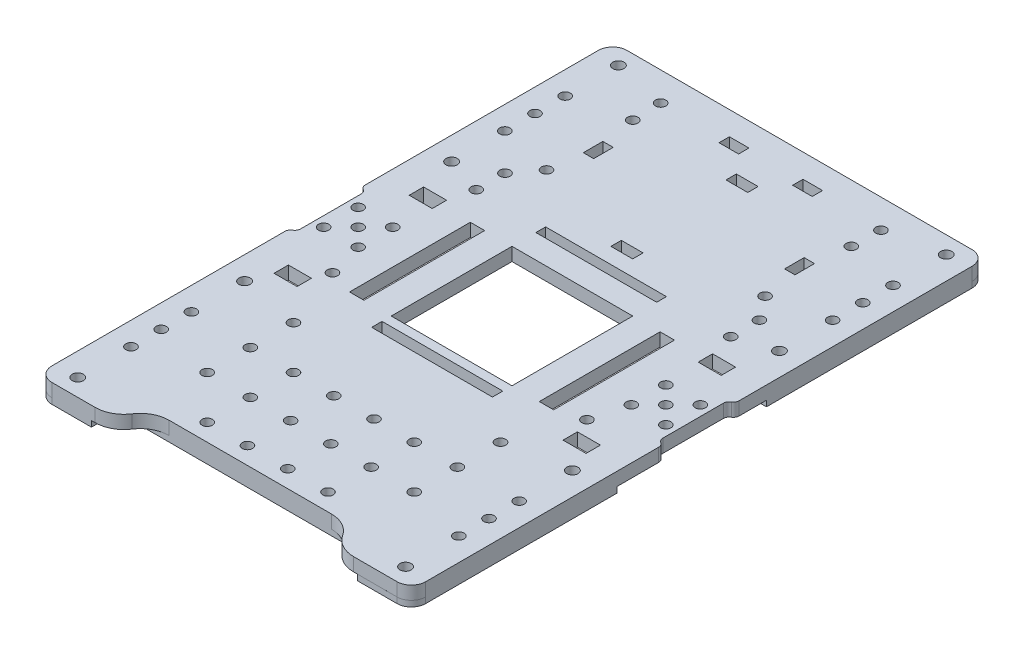
from build123d import *
from build123d.topology import SkipClean

# Parameters (mm, degrees)
SKETCH_2_W           = 130
SKETCH_2_H           = 200
SKETCH_2_R           = 1.8
EXTRUDE_1_DEPTH      = 4.6
FILLET_1_R           = 5
SKETCH_3_W           = 4
SKETCH_3_H           = 24
CUT_EXTRUDE_1_DEPTH  = 4.6
FILLET_2_R           = 2
FILLET_3_R           = 2
SKETCH_4_R           = 1.8
SKETCH_4_R_2         = 1.95
CUT_EXTRUDE_2_DEPTH  = 4.6
SKETCH_5_R           = 1.8
SKETCH_5_W           = 6.8
SKETCH_5_H           = 3.6
SKETCH_5_W_2         = 42
SKETCH_5_H_2         = 42
SKETCH_5_H_3         = 3.4
SKETCH_5_W_3         = 70
SKETCH_5_H_4         = 18
CUT_EXTRUDE_3_DEPTH  = 4.6
FILLET_4_R           = 10
FILLET_5_R           = 10
SKETCH_6_R           = 1.8
CUT_EXTRUDE_4_DEPTH  = 4.6
SKETCH_7_R           = 1.8
CUT_EXTRUDE_5_DEPTH  = 4.6
SKETCH_8_W           = 7.56096601
SKETCH_8_H           = 3.597038402
SKETCH_8_H_2         = 3.621629188
SKETCH_8_W_2         = 3.6
SKETCH_8_H_3         = 6.8
CUT_EXTRUDE_6_DEPTH  = 4.6
SKETCH_10_R          = 1.8
CUT_EXTRUDE_8_DEPTH  = 4.6
SKETCH_9_W           = 8
SKETCH_9_H           = 5
SKETCH_9_W_2         = 5
SKETCH_9_H_2         = 42
CUT_EXTRUDE_9_DEPTH  = 4.6
EXTRUDE_START        = 2
SKETCH_12_W          = 18.75
SKETCH_12_H          = 71.5
SKETCH_12_R          = 1.95
SKETCH_12_R_2        = 1.8
SKETCH_12_R_3        = 1.814304703
SKETCH_12_W_2        = 4
SKETCH_12_H_2        = 2
SKETCH_12_W_3        = 44.25
SKETCH_12_H_3        = 9.499668345
SKETCH_12_H_4        = 71.502072164
SKETCH_12_H_5        = 4.00066331
SKETCH_12_H_6        = 10.999668345
SKETCH_12_H_7        = 10.799999999
SKETCH_12_W_4        = 15.750000002
SKETCH_12_H_8        = 4
SKETCH_12_W_5        = 24.499999998
SKETCH_12_W_6        = 24.5
SKETCH_12_W_7        = 15.75
SKETCH_12_H_9        = 11
SKETCH_12_H_10       = 10.8
SKETCH_12_H_11       = 0.5
SKETCH_12_W_8        = 15.750000003
SKETCH_12_W_9        = 3.999999999
SKETCH_12_W_10       = 14.75
SKETCH_12_H_12       = 76.497927836
SKETCH_12_H_13       = 76.5
SKETCH_12_H_14       = 11.97
SKETCH_12_H_15       = 9.167588033
SKETCH_12_H_16       = 0.69
SKETCH_12_H_17       = 1.832411967
SKETCH_12_H_18       = 1.142411967
SKETCH_12_H_19       = 1.059701493
SKETCH_12_H_20       = 8.290597014
SKETCH_12_H_21       = 1.559701493
EXTRUDE_2_DEPTH      = 2
SKETCH_13_W          = 30
SKETCH_13_H          = 4
EXTRUDE_3_DEPTH      = 2
FILLET_6_R           = 5
SKETCH_14_W          = 42
SKETCH_14_H          = 3.4
EXTRUDE_4_DEPTH      = 4.6
SKETCH_15_W          = 42
SKETCH_15_H          = 3.6
CUT_EXTRUDE_10_DEPTH = 10


# Some blends are built 0.0001 mm under size
with BuildPart() as part:
    # 草图2 → 凸台-拉伸1 (new body)
    with BuildSketch(Plane(origin=(0, 0, 0), x_dir=(1, 0, 0), z_dir=(0, 1, 0))):
        Rectangle(SKETCH_2_W, SKETCH_2_H)
        with Locations(Location((-59.5, 6, 0), (0, 0, 270))):
            Circle(SKETCH_2_R, mode=Mode.SUBTRACT)
        with Locations(Location((-47.5, 6, 0), (0, 0, 270))):
            Circle(SKETCH_2_R, mode=Mode.SUBTRACT)
        with Locations(Location((-59.5, -6, 0), (0, 0, 270))):
            Circle(SKETCH_2_R, mode=Mode.SUBTRACT)
        with Locations(Location((-47.5, -6, 0), (0, 0, 270))):
            Circle(SKETCH_2_R, mode=Mode.SUBTRACT)
        with Locations(Location((-53.5, 0, 0), (0, 0, 270))):
            Circle(SKETCH_2_R, mode=Mode.SUBTRACT)
        with Locations(Location((53.5, 0, 0), (0, 0, 270))):
            Circle(SKETCH_2_R, mode=Mode.SUBTRACT)
        with Locations(Location((59.5, 6, 0), (0, 0, 270))):
            Circle(SKETCH_2_R, mode=Mode.SUBTRACT)
        with Locations(Location((59.5, -6, 0), (0, 0, 270))):
            Circle(SKETCH_2_R, mode=Mode.SUBTRACT)
        with Locations(Location((47.5, -6, 0), (0, 0, 270))):
            Circle(SKETCH_2_R, mode=Mode.SUBTRACT)
        with Locations(Location((47.5, 6, 0), (0, 0, 270))):
            Circle(SKETCH_2_R, mode=Mode.SUBTRACT)
    extrude(amount=EXTRUDE_1_DEPTH)

    # 圆角1
    fillet_1_edges = [part.edges().sort_by_distance(p)[0] for p in [
        (65, 2.3, 100),
        (-65, 2.3, 100),
        (-65, 2.3, -100),
        (65, 2.3, -100),
    ]]
    fillet(fillet_1_edges, radius=FILLET_1_R)

    # 草图3 → 切除-拉伸1 (cut)
    with BuildSketch(Plane(origin=(0, 4.6, 0), x_dir=(1, 0, 0), z_dir=(0, 1, 0))):
        with Locations((-65, 0)):
            Rectangle(SKETCH_3_W, SKETCH_3_H)
        with Locations((65, 0)):
            Rectangle(SKETCH_3_W, SKETCH_3_H)
    extrude(amount=-CUT_EXTRUDE_1_DEPTH, mode=Mode.SUBTRACT)

    # 圆角2
    fillet_2_edges = [part.edges().sort_by_distance(p)[0] for p in [
        (65, 2.3, 12),
        (65, 2.3, -12),
        (-65, 2.3, 12),
        (-65, 2.3, -12),
    ]]
    fillet(fillet_2_edges, radius=FILLET_2_R - 0.0001)  # a hair under: the kernel refuses the full size

    # 圆角3
    fillet_3_edges = [part.edges().sort_by_distance(p)[0] for p in [
        (-63, 2.3, 12),
        (-63, 2.3, -12),
        (63, 2.3, -12),
        (63, 2.3, 12),
    ]]
    fillet(fillet_3_edges, radius=FILLET_3_R)

    # 草图4 → 切除-拉伸2 (cut)
    with BuildSketch(Plane(origin=(0, 0, 0), x_dir=(1, 0, 0), z_dir=(0, 1, 0))):
        with Locations(Location((57, 65, 0), (0, 0, 270))):
            Circle(SKETCH_4_R)
        with Locations(Location((57, 75.5, 0), (0, 0, 270))):
            Circle(SKETCH_4_R)
        with Locations(Location((57, 54.5, 0), (0, 0, 270))):
            Circle(SKETCH_4_R)
        with Locations(Location((57, 94, 0), (0, 0, 270))):
            Circle(SKETCH_4_R_2)
        with Locations(Location((57, 36, 0), (0, 0, 270))):
            Circle(SKETCH_4_R_2)
        with Locations(Location((-57, 94, 0), (0, 0, 270))):
            Circle(SKETCH_4_R_2)
        with Locations(Location((-57, 75.5, 0), (0, 0, 270))):
            Circle(SKETCH_4_R)
        with Locations(Location((-57, 65, 0), (0, 0, 270))):
            Circle(SKETCH_4_R)
        with Locations(Location((-57, 54.5, 0), (0, 0, 270))):
            Circle(SKETCH_4_R)
        with Locations(Location((-57, 36, 0), (0, 0, 270))):
            Circle(SKETCH_4_R_2)
        with Locations(Location((-57, -36, 0), (0, 0, 270))):
            Circle(SKETCH_4_R_2)
        with Locations(Location((-57, -65, 0), (0, 0, 270))):
            Circle(SKETCH_4_R)
        with Locations(Location((-57, -54.5, 0), (0, 0, 270))):
            Circle(SKETCH_4_R)
        with Locations(Location((-57, -75.5, 0), (0, 0, 270))):
            Circle(SKETCH_4_R)
        with Locations(Location((-57, -94, 0), (0, 0, 270))):
            Circle(SKETCH_4_R_2)
        with Locations(Location((57, -65, 0), (0, 0, 270))):
            Circle(SKETCH_4_R)
        with Locations(Location((57, -75.5, 0), (0, 0, 270))):
            Circle(SKETCH_4_R)
        with Locations(Location((57, -54.5, 0), (0, 0, 270))):
            Circle(SKETCH_4_R)
        with Locations(Location((57, -36, 0), (0, 0, 270))):
            Circle(SKETCH_4_R_2)
        with Locations(Location((57, -94, 0), (0, 0, 270))):
            Circle(SKETCH_4_R_2)
    extrude(amount=CUT_EXTRUDE_2_DEPTH, mode=Mode.SUBTRACT)

    # 草图5 → 切除-拉伸3 (cut)
    with BuildSketch(Plane(origin=(0, 4.6, 0), x_dir=(1, 0, 0), z_dir=(0, 1, 0))):
        with Locations(Location((38.3, 90, 0), (0, 0, 270))):
            Circle(SKETCH_5_R)
        with Locations(Location((-38.3, 90, 0), (0, 0, 270))):
            Circle(SKETCH_5_R)
        with Locations((-12.8, 90)):
            Rectangle(SKETCH_5_W, SKETCH_5_H)
        with Locations((12.8, 90)):
            Rectangle(SKETCH_5_W, SKETCH_5_H)
        Rectangle(SKETCH_5_W_2, SKETCH_5_H_2)
        with Locations((0, 31)):
            Rectangle(SKETCH_5_W_2, SKETCH_5_H_3)
        with Locations((0, -31)):
            Rectangle(SKETCH_5_W_2, SKETCH_5_H_3)
        with Locations((0, -100)):
            Rectangle(SKETCH_5_W_3, SKETCH_5_H_4)
    extrude(amount=-CUT_EXTRUDE_3_DEPTH, mode=Mode.SUBTRACT)

    # 圆角4
    # the kernel refuses this fillet: 10 mm, written as the material it takes off along each edge
    with BuildSketch(Plane(origin=(-35, -24.874685928, 100), x_dir=(-1, 0, 0), z_dir=(0, 1, 0))) as fillet_4_piece_1:
        with BuildLine():
            CenterArc((9.949874371, -10), FILLET_4_R, 90, 84.260829523)
            Line((0, -9), (-0.198997487, -8.98))
            ThreePointArc((-0.198997487, -8.98), (-0.2, -4.5), (-0.2, 0))
            Line((-0.2, 0), (0, 0.2))
            Line((0, 0.2), (9.949874371, 0.2))
            Line((9.949874371, 0.2), (9.949874371, 0))
        make_face()
    extrude(amount=54.349371855, mode=Mode.SUBTRACT)
    with BuildSketch(Plane(origin=(35, 29.474685928, 100), x_dir=(0, 0, -1), z_dir=(0, -1, 0))) as fillet_4_piece_2:
        with BuildLine():
            CenterArc((10, 9.949874371), FILLET_4_R, 180, 84.260829523)
            Line((0, 9.949874371), (-0.2, 9.949874371))
            Line((-0.2, 9.949874371), (-0.2, 0))
            Line((-0.2, 0), (0, -0.2))
            ThreePointArc((0, -0.2), (4.5, -0.2), (8.98, -0.198997487))
            Line((8.98, -0.198997487), (9, 0))
        make_face()
    extrude(amount=54.349371855, mode=Mode.SUBTRACT)

    # 圆角5
    fillet_5_edges = [part.edges().sort_by_distance(p)[0] for p in [
        (35, 2.3, 91),
        (-35, 2.3, 91),
    ]]
    fillet(fillet_5_edges, radius=FILLET_5_R)

    # 草图6 → 切除-拉伸4 (cut)
    with BuildSketch(Plane(origin=(0, 4.6, 0), x_dir=(1, 0, 0), z_dir=(0, 1, 0))):
        with Locations(Location((-7, -85, 0), (0, 0, 270))):
            Circle(SKETCH_6_R)
        with Locations(Location((-21, -85, 0), (0, 0, 270))):
            Circle(SKETCH_6_R)
        with Locations(Location((7, -85, 0), (0, 0, 270))):
            Circle(SKETCH_6_R)
        with Locations(Location((21, -85, 0), (0, 0, 270))):
            Circle(SKETCH_6_R)
        with Locations(Location((21, -70, 0), (0, 0, 270))):
            Circle(SKETCH_6_R)
        with Locations(Location((7, -70, 0), (0, 0, 270))):
            Circle(SKETCH_6_R)
        with Locations(Location((-7, -70, 0), (0, 0, 270))):
            Circle(SKETCH_6_R)
        with Locations(Location((-21, -70, 0), (0, 0, 270))):
            Circle(SKETCH_6_R)
        with Locations(Location((-21, -55, 0), (0, 0, 270))):
            Circle(SKETCH_6_R)
        with Locations(Location((-7, -55, 0), (0, 0, 270))):
            Circle(SKETCH_6_R)
        with Locations(Location((7, -55, 0), (0, 0, 270))):
            Circle(SKETCH_6_R)
        with Locations(Location((21, -55, 0), (0, 0, 270))):
            Circle(SKETCH_6_R)
        with Locations(Location((36, -70, 0), (0, 0, 270))):
            Circle(SKETCH_6_R)
        with Locations(Location((36, -55, 0), (0, 0, 270))):
            Circle(SKETCH_6_R)
        with Locations(Location((36, -40, 0), (0, 0, 270))):
            Circle(SKETCH_6_R)
        with Locations(Location((-36, -40, 0), (0, 0, 270))):
            Circle(SKETCH_6_R)
        with Locations(Location((-36, -55, 0), (0, 0, 270))):
            Circle(SKETCH_6_R)
        with Locations(Location((-36, -70, 0), (0, 0, 270))):
            Circle(SKETCH_6_R)
    extrude(amount=-CUT_EXTRUDE_4_DEPTH, mode=Mode.SUBTRACT)

    # 草图7 → 切除-拉伸5 (cut)
    with BuildSketch(Plane(origin=(0, 4.6, 0), x_dir=(1, 0, 0), z_dir=(0, 1, 0))):
        with Locations(Location((-38, 80, 0), (0, 0, 270))):
            Circle(SKETCH_7_R)
        with Locations(Location((38, 80, 0), (0, 0, 270))):
            Circle(SKETCH_7_R)
        with Locations(Location((38, 50, 0), (0, 0, 270))):
            Circle(SKETCH_7_R)
        with Locations(Location((-38, 50, 0), (0, 0, 270))):
            Circle(SKETCH_7_R)
    extrude(amount=-CUT_EXTRUDE_5_DEPTH, mode=Mode.SUBTRACT)

    # 草图8 → 切除-拉伸6 (cut)
    with BuildSketch(Plane(origin=(0, 4.6, 0), x_dir=(1, 0, 0), z_dir=(0, 1, 0))):
        with Locations((0, 80)):
            Rectangle(SKETCH_8_W, SKETCH_8_H)
        with Locations((0, 40)):
            Rectangle(SKETCH_8_W, SKETCH_8_H_2)
        with Locations((35, 65)):
            Rectangle(SKETCH_8_W_2, SKETCH_8_H_3)
        with Locations((-35, 65)):
            Rectangle(SKETCH_8_W_2, SKETCH_8_H_3)
    extrude(amount=-CUT_EXTRUDE_6_DEPTH, mode=Mode.SUBTRACT)

    # 草图10 → 切除-拉伸8 (cut)
    with BuildSketch(Plane(origin=(0, 4.6, 0), x_dir=(1, 0, 0), z_dir=(0, 1, 0))):
        with Locations(Location((44.25, 41.8, 0), (0, 0, 270))):
            Circle(SKETCH_10_R)
        with Locations(Location((-44.25, 41.810125838, 0), (0, 0, 270))):
            Circle(SKETCH_10_R)
        with Locations(Location((-44.25, -18.189874162, 0), (0, 0, 270))):
            Circle(SKETCH_10_R)
        with Locations(Location((44.25, -18.2, 0), (0, 0, 270))):
            Circle(SKETCH_10_R)
        with Locations(Location((-44.25, 31.810125838, 0), (0, 0, 270))):
            Circle(SKETCH_10_R)
        with Locations(Location((44.25, 31.810125838, 0), (0, 0, 270))):
            Circle(SKETCH_10_R)
    extrude(amount=-CUT_EXTRUDE_8_DEPTH, mode=Mode.SUBTRACT)

    # 草图9 → 切除-拉伸9 (cut)
    with BuildSketch(Plane(origin=(0, 4.6, 0), x_dir=(1, 0, 0), z_dir=(0, 1, 0))):
        with Locations((-50.25, 21)):
            Rectangle(SKETCH_9_W, SKETCH_9_H)
        with Locations((50.25, 21)):
            Rectangle(SKETCH_9_W, SKETCH_9_H)
        with Locations((-50.25, -26)):
            Rectangle(SKETCH_9_W, SKETCH_9_H)
        with Locations((50.25, -26)):
            Rectangle(SKETCH_9_W, SKETCH_9_H)
        with Locations((33, 0)):
            Rectangle(SKETCH_9_W_2, SKETCH_9_H_2)
        with Locations((-33, 0)):
            Rectangle(SKETCH_9_W_2, SKETCH_9_H_2)
    extrude(amount=-CUT_EXTRUDE_9_DEPTH, mode=Mode.SUBTRACT)

    # 草图12 → 凸台-拉伸2 (add)
    # profile 1 of 46: a face of its own
    with BuildSketch(Plane.XZ.offset(EXTRUDE_START)):
        with Locations((-55.625, 64.25)):
            Rectangle(SKETCH_12_W, SKETCH_12_H)
        with Locations(Location((-57, 36, 0), (0, 0, 270))):
            Circle(SKETCH_12_R, mode=Mode.SUBTRACT)
        with Locations(Location((-57, 54.5, 0), (0, 0, 270))):
            Circle(SKETCH_12_R_2, mode=Mode.SUBTRACT)
        with Locations(Location((-57, 65, 0), (0, 0, 270))):
            Circle(SKETCH_12_R_3, mode=Mode.SUBTRACT)
        with Locations(Location((-57, 75.5, 0), (0, 0, 270))):
            Circle(SKETCH_12_R_2, mode=Mode.SUBTRACT)
        with Locations(Location((-57, 94, 0), (0, 0, 270))):
            Circle(SKETCH_12_R, mode=Mode.SUBTRACT)
    # profile 2 of 46: a face of its own
    with BuildSketch(Plane.XZ.offset(EXTRUDE_START)):
        with Locations((0, 90)):
            Rectangle(SKETCH_12_W_2, SKETCH_12_H_2)
    # profile 3 of 46: a face of its own
    with BuildSketch(Plane.XZ.offset(EXTRUDE_START)):
        with Locations((24.125, 90)):
            Rectangle(SKETCH_12_W_3, SKETCH_12_H_2)
    # profile 4 of 46: a face of its own
    with BuildSketch(Plane.XZ.offset(EXTRUDE_START)):
        with Locations((-24.125, 90)):
            Rectangle(SKETCH_12_W_3, SKETCH_12_H_2)
    # profile 5 of 46: a face of its own
    with BuildSketch(Plane.XZ.offset(EXTRUDE_START)):
        with Locations((0, 84.250165828)):
            Rectangle(SKETCH_12_W_2, SKETCH_12_H_3)
    # profile 6 of 46: a face of its own
    with BuildSketch(Plane.XZ.offset(EXTRUDE_START)):
        with Locations((55.625, 64.251036082)):
            Rectangle(SKETCH_12_W, SKETCH_12_H_4)
        with Locations(Location((57, 36, 0), (0, 0, 270))):
            Circle(SKETCH_12_R, mode=Mode.SUBTRACT)
        with Locations(Location((57, 54.5, 0), (0, 0, 270))):
            Circle(SKETCH_12_R_2, mode=Mode.SUBTRACT)
        with Locations(Location((57, 65, 0), (0, 0, 270))):
            Circle(SKETCH_12_R_2, mode=Mode.SUBTRACT)
        with Locations(Location((57, 75.5, 0), (0, 0, 270))):
            Circle(SKETCH_12_R_2, mode=Mode.SUBTRACT)
        with Locations(Location((57, 94, 0), (0, 0, 270))):
            Circle(SKETCH_12_R, mode=Mode.SUBTRACT)
    # profile 7 of 46: a face of its own
    with BuildSketch(Plane.XZ.offset(EXTRUDE_START)):
        with Locations((24.125, 77.5)):
            Rectangle(SKETCH_12_W_3, SKETCH_12_H_5)
    # profile 8 of 46: a face of its own
    with BuildSketch(Plane.XZ.offset(EXTRUDE_START)):
        with Locations((0, 77.5)):
            Rectangle(SKETCH_12_W_2, SKETCH_12_H_5)
    # profile 9 of 46: a face of its own
    with BuildSketch(Plane.XZ.offset(EXTRUDE_START)):
        with Locations((-24.125, 77.5)):
            Rectangle(SKETCH_12_W_3, SKETCH_12_H_5)
    # profile 10 of 46: a face of its own
    with BuildSketch(Plane.XZ.offset(EXTRUDE_START)):
        with Locations((0, 69.999834173)):
            Rectangle(SKETCH_12_W_2, SKETCH_12_H_6)
    # profile 11 of 46: a face of its own
    with BuildSketch(Plane.XZ.offset(EXTRUDE_START)):
        with Locations((28.5, 69.9)):
            Rectangle(SKETCH_12_W_2, SKETCH_12_H_7)
    # profile 12 of 46: a face of its own
    with BuildSketch(Plane.XZ.offset(EXTRUDE_START)):
        with Locations((-28.499999998, 69.9)):
            Rectangle(SKETCH_12_W_2, SKETCH_12_H_7)
    # profile 13 of 46: a face of its own
    with BuildSketch(Plane.XZ.offset(EXTRUDE_START)):
        with Locations((-38.374999999, 62.5)):
            Rectangle(SKETCH_12_W_4, SKETCH_12_H_8)
    # profile 14 of 46: a face of its own
    with BuildSketch(Plane.XZ.offset(EXTRUDE_START)):
        with Locations((-28.499999998, 62.5)):
            Rectangle(SKETCH_12_W_2, SKETCH_12_H_8)
    # profile 15 of 46: a face of its own
    with BuildSketch(Plane.XZ.offset(EXTRUDE_START)):
        with Locations((-14.249999999, 62.5)):
            Rectangle(SKETCH_12_W_5, SKETCH_12_H_8)
    # profile 16 of 46: a face of its own
    with BuildSketch(Plane.XZ.offset(EXTRUDE_START)):
        with Locations((0, 62.5)):
            Rectangle(SKETCH_12_W_2, SKETCH_12_H_8)
    # profile 17 of 46: a face of its own
    with BuildSketch(Plane.XZ.offset(EXTRUDE_START)):
        with Locations((14.25, 62.5)):
            Rectangle(SKETCH_12_W_6, SKETCH_12_H_8)
    # profile 18 of 46: a face of its own
    with BuildSketch(Plane.XZ.offset(EXTRUDE_START)):
        with Locations((28.5, 62.5)):
            Rectangle(SKETCH_12_W_2, SKETCH_12_H_8)
    # profile 19 of 46: a face of its own
    with BuildSketch(Plane.XZ.offset(EXTRUDE_START)):
        with Locations((38.375, 62.5)):
            Rectangle(SKETCH_12_W_7, SKETCH_12_H_8)
    # profile 20 of 46: a face of its own
    with BuildSketch(Plane.XZ.offset(EXTRUDE_START)):
        with Locations((28.5, 55)):
            Rectangle(SKETCH_12_W_2, SKETCH_12_H_9)
    # profile 21 of 46: a face of its own
    with BuildSketch(Plane.XZ.offset(EXTRUDE_START)):
        with Locations((38.375, 47.5)):
            Rectangle(SKETCH_12_W_7, SKETCH_12_H_8)
    # profile 22 of 46: a face of its own
    with BuildSketch(Plane.XZ.offset(EXTRUDE_START)):
        with Locations((28.5, 40.1)):
            Rectangle(SKETCH_12_W_2, SKETCH_12_H_10)
    # profile 23 of 46: a face of its own
    with BuildSketch(Plane.XZ.offset(EXTRUDE_START)):
        Polygon((-46.25, 34.7), (-46.25, 32.7), (46.25, 32.7), (46.25, 34.7), (30.5, 34.7), (26.5, 34.7), (-26.499999999, 34.7), (-30.499999997, 34.7), align=None)
    # profile 24 of 46: a face of its own
    with BuildSketch(Plane.XZ.offset(EXTRUDE_START)):
        with Locations((28.5, 47.5)):
            Rectangle(SKETCH_12_W_2, SKETCH_12_H_8)
    # profile 25 of 46: a face of its own
    with BuildSketch(Plane.XZ.offset(EXTRUDE_START)):
        Polygon((-26.499999998, 49.5), (-26.499999998, 45.5), (26.5, 45.5), (26.5, 49.5), (2, 49.5), (2, 49), (-2, 49), (-2, 49.5), align=None)
    # profile 26 of 46: a face of its own
    with BuildSketch(Plane.XZ.offset(EXTRUDE_START)):
        with Locations((0, 55)):
            Rectangle(SKETCH_12_W_2, SKETCH_12_H_9)
    # profile 27 of 46: a face of its own
    with BuildSketch(Plane.XZ.offset(EXTRUDE_START)):
        with Locations((0, 49.25)):
            Rectangle(SKETCH_12_W_2, SKETCH_12_H_11)
    # profile 28 of 46: a face of its own
    with BuildSketch(Plane.XZ.offset(EXTRUDE_START)):
        Polygon((-30.499999998, 60.5), (-30.499999997, 49.5), (-26.499999998, 49.5), (-26.499999998, 60.5), align=None)
    # profile 29 of 46: a face of its own
    with BuildSketch(Plane.XZ.offset(EXTRUDE_START)):
        with Locations((-38.374999999, 47.5)):
            Rectangle(SKETCH_12_W_8, SKETCH_12_H_8)
    # profile 30 of 46: a face of its own
    with BuildSketch(Plane.XZ.offset(EXTRUDE_START)):
        with Locations((-28.499999998, 47.5)):
            Rectangle(SKETCH_12_W_9, SKETCH_12_H_8)
    # profile 31 of 46: a face of its own
    with BuildSketch(Plane.XZ.offset(EXTRUDE_START)):
        Polygon((-30.499999997, 45.5), (-30.499999997, 34.699999999), (-26.499999999, 34.7), (-26.499999998, 45.5), align=None)
    # profile 32 of 46: a face of its own
    with BuildSketch(Plane.XZ.offset(EXTRUDE_START)):
        with Locations((57.625, -61.748963918)):
            Rectangle(SKETCH_12_W_10, SKETCH_12_H_12)
        with Locations(Location((57, -94, 0), (0, 0, 270))):
            Circle(SKETCH_12_R, mode=Mode.SUBTRACT)
        with Locations(Location((57, -75.5, 0), (0, 0, 270))):
            Circle(SKETCH_12_R_2, mode=Mode.SUBTRACT)
        with Locations(Location((57, -65, 0), (0, 0, 270))):
            Circle(SKETCH_12_R_2, mode=Mode.SUBTRACT)
        with Locations(Location((57, -54.5, 0), (0, 0, 270))):
            Circle(SKETCH_12_R_2, mode=Mode.SUBTRACT)
        with Locations(Location((57, -36, 0), (0, 0, 270))):
            Circle(SKETCH_12_R, mode=Mode.SUBTRACT)
    # profile 33 of 46: a face of its own
    with BuildSketch(Plane.XZ.offset(EXTRUDE_START)):
        with Locations((-57.625, -61.75)):
            Rectangle(SKETCH_12_W_10, SKETCH_12_H_13)
        with Locations(Location((-57, -36, 0), (0, 0, 270))):
            Circle(SKETCH_12_R, mode=Mode.SUBTRACT)
        with Locations(Location((-57, -54.5, 0), (0, 0, 270))):
            Circle(SKETCH_12_R_2, mode=Mode.SUBTRACT)
        with Locations(Location((-57, -65, 0), (0, 0, 270))):
            Circle(SKETCH_12_R_2, mode=Mode.SUBTRACT)
        with Locations(Location((-57, -75.5, 0), (0, 0, 270))):
            Circle(SKETCH_12_R_2, mode=Mode.SUBTRACT)
        with Locations(Location((-57, -94, 0), (0, 0, 270))):
            Circle(SKETCH_12_R, mode=Mode.SUBTRACT)
    # profile 34 of 46: a face of its own
    with BuildSketch(Plane.XZ.offset(EXTRUDE_START)):
        Polygon((50.25, -54.875), (-50.25, -54.875), (-50.25, -58.875), (-2, -58.875), (2, -58.875), (50.25, -58.875), align=None)
    # profile 35 of 46: a face of its own
    with BuildSketch(Plane.XZ.offset(EXTRUDE_START)):
        with Locations((0, -64.86)):
            Rectangle(SKETCH_12_W_2, SKETCH_12_H_14)
    # profile 36 of 46: a face of its own
    with BuildSketch(Plane.XZ.offset(EXTRUDE_START)):
        Polygon((-2, -70.845), (-50.25, -70.845), (-50.25, -74.845), (-21.990241502, -74.845), (-21.990241502, -74.155), (-17.990241502, -74.155), (-17.990241502, -74.845), (17.990241502, -74.845), (21.990241502, -74.845), (50.25, -74.845), (50.25, -70.845), (2, -70.845), align=None)
    # profile 37 of 46: a face of its own
    with BuildSketch(Plane.XZ.offset(EXTRUDE_START)):
        with Locations((19.990241502, -79.428794017)):
            Rectangle(SKETCH_12_W_2, SKETCH_12_H_15)
    # profile 38 of 46: a face of its own
    with BuildSketch(Plane.XZ.offset(EXTRUDE_START)):
        with Locations((-19.990241502, -79.428794017)):
            Rectangle(SKETCH_12_W_2, SKETCH_12_H_15)
    # profile 39 of 46: a face of its own
    with BuildSketch(Plane.XZ.offset(EXTRUDE_START)):
        with Locations((-19.990241502, -74.5)):
            Rectangle(SKETCH_12_W_2, SKETCH_12_H_16)
    # profile 40 of 46: a face of its own
    with BuildSketch(Plane.XZ.offset(EXTRUDE_START)):
        Polygon((-50.25, -84.012588033), (-50.25, -86.012588033), (-2, -86.012588033), (-2, -84.95288654), (2, -84.95288654), (2, -86.012588033), (50.25, -86.012588033), (50.25, -84.012588033), (21.990241502, -84.012588033), (21.990241502, -85.155), (17.990241502, -85.155), (17.990241502, -84.012588033), (-17.990241502, -84.012588033), (-17.990241502, -85.845), (-21.990241502, -85.845), (-21.990241502, -84.012588033), align=None)
    # profile 41 of 46: a face of its own
    with BuildSketch(Plane.XZ.offset(EXTRUDE_START)):
        with Locations((-19.990241502, -84.928794017)):
            Rectangle(SKETCH_12_W_2, SKETCH_12_H_17)
    # profile 42 of 46: a face of its own
    with BuildSketch(Plane.XZ.offset(EXTRUDE_START)):
        with Locations((19.990241502, -84.583794017)):
            Rectangle(SKETCH_12_W_2, SKETCH_12_H_18)
    # profile 43 of 46: a face of its own
    with BuildSketch(Plane.XZ.offset(EXTRUDE_START)):
        with Locations((0, -85.482737286)):
            Rectangle(SKETCH_12_W_2, SKETCH_12_H_19)
    # profile 44 of 46: a face of its own
    with BuildSketch(Plane.XZ.offset(EXTRUDE_START)):
        with Locations((0, -90.15788654)):
            Rectangle(SKETCH_12_W_2, SKETCH_12_H_20)
    # profile 45 of 46: a face of its own
    with BuildSketch(Plane.XZ.offset(EXTRUDE_START)):
        Polygon((-50.25, -94.303185047), (-50.25, -97.303185047), (50.25, -97.303185047), (50.25, -94.303185047), (2, -94.303185047), (2, -95.86288654), (-2, -95.86288654), (-2, -94.303185047), align=None)
    # profile 46 of 46: a face of its own
    with BuildSketch(Plane.XZ.offset(EXTRUDE_START)):
        with Locations((0, -95.083035794)):
            Rectangle(SKETCH_12_W_2, SKETCH_12_H_21)
    extrude(amount=-EXTRUDE_2_DEPTH)

    # 草图13 → 凸台-拉伸3 (add)
    with SkipClean():  # the faces are left unmerged after this step: merging them gives an invalid solid
        with BuildSketch(Plane.XZ):
            with Locations((0, -43.810814594)):
                Rectangle(SKETCH_13_W, SKETCH_13_H)
        extrude(amount=EXTRUDE_3_DEPTH)
    add(part.part.scale(1), mode=Mode.REPLACE)  # the faces are merged on a copy

    # 圆角6
    # the kernel refuses this fillet: 5 mm, written as the material it takes off along each edge
    with BuildSketch(Plane(origin=(-65, -2, 100), x_dir=(1, 0, 0), z_dir=(0, 1, 0)), Plane(origin=(65, -2, 100.002072164), x_dir=(0, 0, -1), z_dir=(0, 1, 0)), Plane(origin=(-65, -2, -100), x_dir=(0, 0, 1), z_dir=(0, 1, 0))) as fillet_6_piece_1:
        with BuildLine():
            CenterArc((FILLET_6_R, FILLET_6_R), FILLET_6_R, 180, 90)
            Line((0, FILLET_6_R), (-FILLET_6_R * 0.02, FILLET_6_R))
            Line((-FILLET_6_R * 0.02, FILLET_6_R), (-FILLET_6_R * 0.02, -FILLET_6_R * 0.02))
            Line((-FILLET_6_R * 0.02, -FILLET_6_R * 0.02), (FILLET_6_R, -FILLET_6_R * 0.02))
            Line((FILLET_6_R, -FILLET_6_R * 0.02), (FILLET_6_R, 0))
        make_face()
    extrude(amount=2, mode=Mode.SUBTRACT)
    with BuildSketch(Plane(origin=(65, -2, -99.997927836), x_dir=(0, 0, 1), z_dir=(0, 1, 0))) as fillet_6_piece_2:
        with BuildLine():
            CenterArc((FILLET_6_R, -FILLET_6_R), FILLET_6_R, 90, 90)
            Line((0, -FILLET_6_R), (-FILLET_6_R * 0.02, -FILLET_6_R))
            Line((-FILLET_6_R * 0.02, -FILLET_6_R), (-FILLET_6_R * 0.02, FILLET_6_R * 0.02))
            Line((-FILLET_6_R * 0.02, FILLET_6_R * 0.02), (FILLET_6_R, FILLET_6_R * 0.02))
            Line((FILLET_6_R, FILLET_6_R * 0.02), (FILLET_6_R, 0))
        make_face()
    extrude(amount=2, mode=Mode.SUBTRACT)

    # 草图14 → 凸台-拉伸4 (add)
    with BuildSketch(Plane(origin=(0, 4.6, 0), x_dir=(1, 0, 0), z_dir=(0, 1, 0))):
        with Locations((0, -31)):
            Rectangle(SKETCH_14_W, SKETCH_14_H)
    extrude(amount=-EXTRUDE_4_DEPTH)

    # 草图15 → 切除-拉伸10 (cut)
    with BuildSketch(Plane(origin=(0, 4.6, 0), x_dir=(1, 0, 0), z_dir=(0, 1, 0))):
        with Locations((0, -26)):
            Rectangle(SKETCH_15_W, SKETCH_15_H)
    extrude(amount=-CUT_EXTRUDE_10_DEPTH, mode=Mode.SUBTRACT)


solid = part.part
